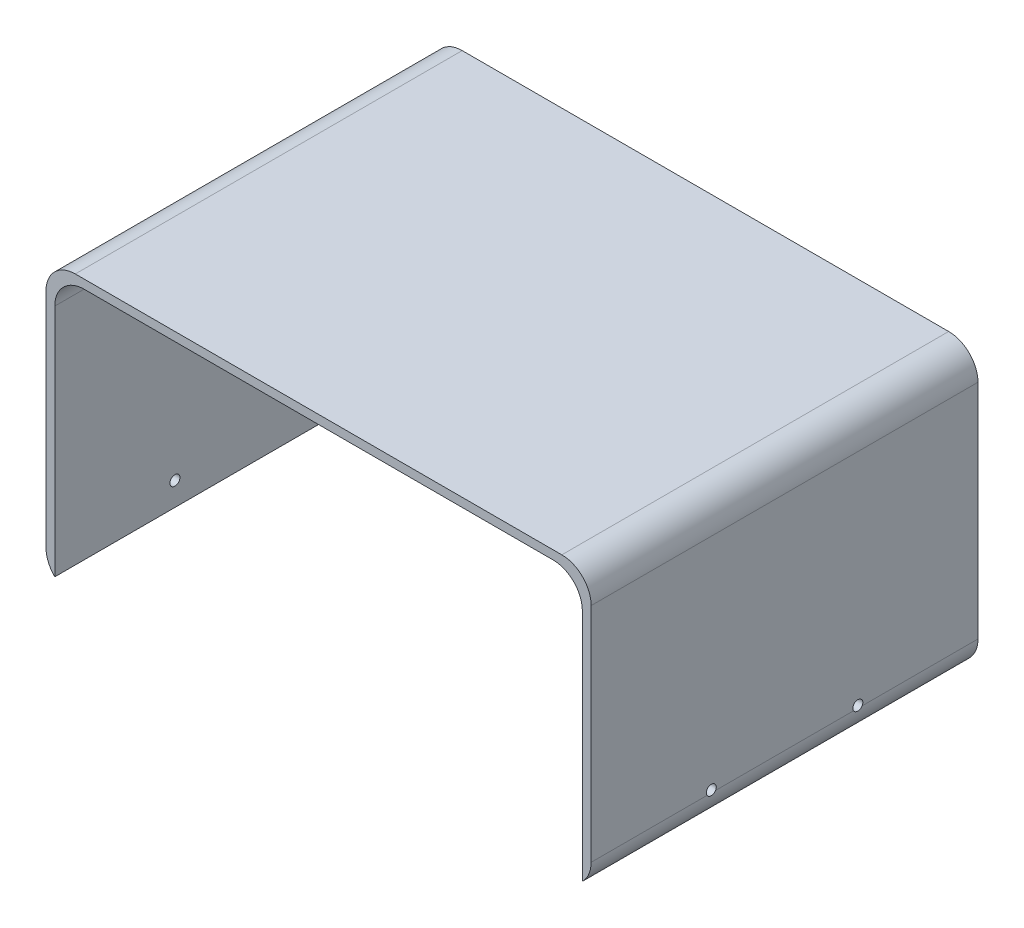
from build123d import *

# Parameters (mm, degrees)
SKETCH1_W               = 132
SKETCH1_H               = 93
BOSS_EXTRUDE1_DEPTH     = 3
SKETCH3_W               = 132
SKETCH3_H               = 3
BOSS_EXTRUDE2_DEPTH     = 180
BOSS_EXTRUDE3_START     = 180
SKETCH4_W               = 132
SKETCH4_H               = 93
BOSS_EXTRUDE3_DEPTH     = 3
FILLET1_R               = 10
FILLET2_R               = 10
CUT_EXTRUDE1_DEPTH      = 245.053272873
CUT_EXTRUDE1_DEPTH_BACK = 245.053272873
SKETCH5_R               = 1.7


with BuildPart() as part:
    # Sketch1 → Boss-Extrude1 (new body)
    with BuildSketch(Plane(origin=(0, 0, 0), x_dir=(0, 0, -1), z_dir=(1, 0, 0))):
        with Locations((66, -46.5)):
            Rectangle(SKETCH1_W, SKETCH1_H)
    extrude(amount=BOSS_EXTRUDE1_DEPTH)

    # Sketch3 → Boss-Extrude2 (add)
    with BuildSketch(Plane.ZY):
        with Locations((-66, -1.5)):
            Rectangle(SKETCH3_W, SKETCH3_H)
    extrude(amount=BOSS_EXTRUDE2_DEPTH)

    # Sketch4 → Boss-Extrude3 (add)
    with BuildSketch(Plane.ZY.offset(BOSS_EXTRUDE3_START)):
        with Locations((-66, -46.5)):
            Rectangle(SKETCH4_W, SKETCH4_H)
    extrude(amount=BOSS_EXTRUDE3_DEPTH)

    # Fillet1
    fillet1_edges = [part.edges().sort_by_distance(p)[0] for p in [
        (0, -3, -66),
        (3, 0, -66),
        (-180, -3, -66),
        (-183, 0, -66),
    ]]
    fillet(fillet1_edges, radius=FILLET1_R)

    # Fillet2
    # the kernel refuses this fillet: 10 mm, written as the material it takes off along each edge
    with BuildSketch(Plane(origin=(3, -93, -149.853571071), x_dir=(0, 1, 0), z_dir=(0, 0, 1)), Plane(origin=(-183, -93, 17.853571071), x_dir=(0, 1, 0), z_dir=(0, 0, -1))) as fillet2_piece_1:
        with BuildLine():
            CenterArc((7.141428429, 10), FILLET2_R, 224.427004001, 45.572995999)
            Line((0, 3), (-0.142828569, 2.86))
            ThreePointArc((-0.142828569, 2.86), (-0.2, 1.5), (-0.2, 0))
            Line((-0.2, 0), (0, -0.2))
            Line((0, -0.2), (7.141428429, -0.2))
            Line((7.141428429, -0.2), (7.141428429, 0))
        make_face()
    extrude(amount=167.707142143, mode=Mode.SUBTRACT)

    # Sketch5 → Cut-Extrude1 (cut, two sides: drawn at the far end of the back side and taken through both)
    with BuildSketch(Plane.ZY.offset(-CUT_EXTRUDE1_DEPTH_BACK)):
        with Locations((-91, -85)):
            Circle(SKETCH5_R)
        with Locations((-41, -85)):
            Circle(SKETCH5_R)
    extrude(amount=CUT_EXTRUDE1_DEPTH + CUT_EXTRUDE1_DEPTH_BACK, mode=Mode.SUBTRACT)


solid = part.part
